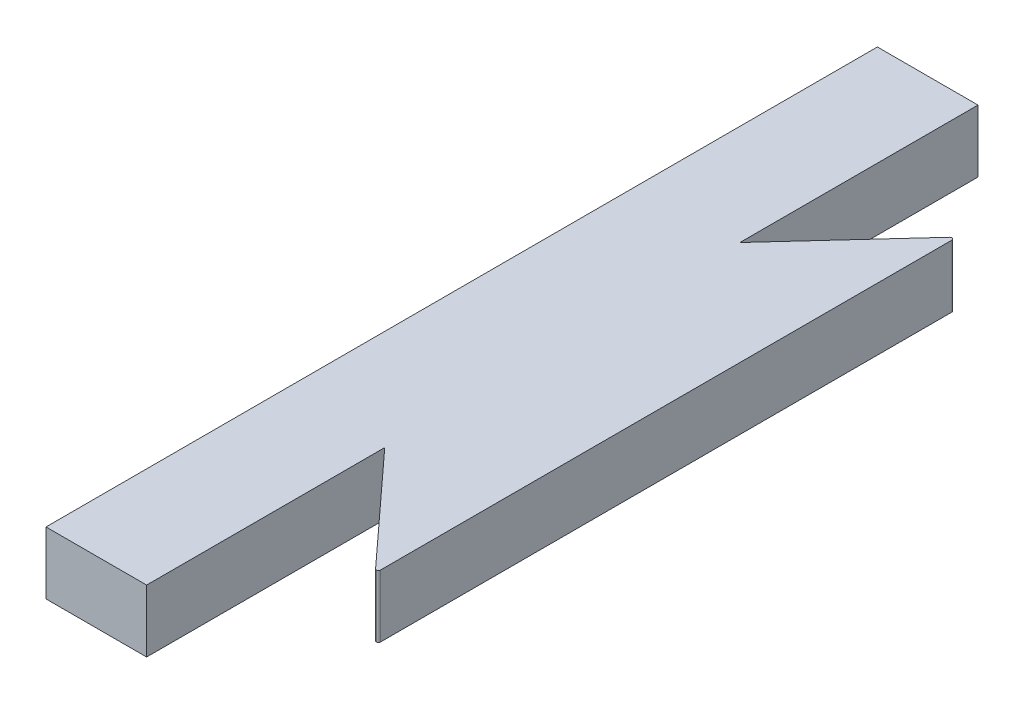
from build123d import *

# Parameters (mm, degrees)
CROQUIS1_R                 = 11
CROQUIS1_R_2               = 2
CROQUIS1_W                 = 30
CROQUIS1_H                 = 3
SALIENTE_EXTRUIR1_DEPTH    = 3
CROQUIS2_R                 = 13
CROQUIS2_R_2               = 11
SALIENTE_EXTRUIR2_DEPTH    = 4
CROQUIS3_R                 = 13
CROQUIS3_R_2               = 9
SALIENTE_EXTRUIR3_DEPTH    = 2
CHAFL_N1_SIZE              = 2
CHAFL_N2_SIZE              = 10
CORTAR_EXTRUIR1_DEPTH      = 10
CORTAR_EXTRUIR1_DEPTH_BACK = 10
CROQUIS4_W                 = 128.833311542
CROQUIS4_H                 = 58.233807115
REDONDEO1_R                = 0.1


with BuildPart() as part:
    # Croquis1 → Saliente-Extruir1 (new body)
    with BuildSketch(Plane(origin=(0, 0, 0), x_dir=(1, 0, 0), z_dir=(0, 1, 0))):
        Polygon((65, 8.543457495), (70, 14), (70, -14), (65, -8.543457495), (65, -20), (-65, -20), (-65, 20), (65, 20), align=None)
        with Locations((-50.129942902, 0)):
            Circle(CROQUIS1_R, mode=Mode.SUBTRACT)
        with Locations((-28.595127909, 0)):
            Circle(CROQUIS1_R_2, mode=Mode.SUBTRACT)
        with Locations((-13.595127909, 0)):
            Circle(CROQUIS1_R_2, mode=Mode.SUBTRACT)
        with Locations((50, 0)):
            Circle(CROQUIS1_R_2, mode=Mode.SUBTRACT)
        with Locations((25, 11)):
            Rectangle(CROQUIS1_W, CROQUIS1_H, mode=Mode.SUBTRACT)
        with Locations((25, -11)):
            Rectangle(CROQUIS1_W, CROQUIS1_H, mode=Mode.SUBTRACT)
    extrude(amount=SALIENTE_EXTRUIR1_DEPTH)

    # Croquis2 → Saliente-Extruir2 (add)
    with BuildSketch(Plane(origin=(0, 3, 0), x_dir=(1, 0, 0), z_dir=(0, 1, 0))):
        with Locations((-50.129942902, 0)):
            Circle(CROQUIS2_R)
        with Locations((-50.129942902, 0)):
            Circle(CROQUIS2_R_2, mode=Mode.SUBTRACT)
    extrude(amount=SALIENTE_EXTRUIR2_DEPTH)

    # Croquis3 → Saliente-Extruir3 (add)
    with BuildSketch(Plane(origin=(0, 7, 0), x_dir=(1, 0, 0), z_dir=(0, 1, 0))):
        with Locations((-50.129942902, 0)):
            Circle(CROQUIS3_R)
        with Locations((-50.129942902, 0)):
            Circle(CROQUIS3_R_2, mode=Mode.SUBTRACT)
    extrude(amount=SALIENTE_EXTRUIR3_DEPTH)

    # Chaflán1
    chafl_n1_edges = [part.edges().sort_by_distance(p)[0] for p in [
        (-63.129942902, 9, 0),
    ]]
    chamfer(chafl_n1_edges, length=CHAFL_N1_SIZE)

    # Chaflán2
    chafl_n2_edges = [part.edges().sort_by_distance(p)[0] for p in [
        (-65, 1.5, 20),
        (-65, 1.5, -20),
    ]]
    chamfer(chafl_n2_edges, length=CHAFL_N2_SIZE)

    # Croquis4 → Cortar-Extruir1 (cut, two sides: drawn at the far end of the back side and taken through both)
    with BuildSketch(Plane(origin=(0, 3, 0), x_dir=(1, 0, 0), z_dir=(0, 1, 0)).offset(-CORTAR_EXTRUIR1_DEPTH_BACK)):
        with Locations((-4.257997369, -0.71893589)):
            Rectangle(CROQUIS4_W, CROQUIS4_H)
    extrude(amount=CORTAR_EXTRUIR1_DEPTH + CORTAR_EXTRUIR1_DEPTH_BACK, mode=Mode.SUBTRACT)

    # Redondeo1
    redondeo1_edges = [part.edges().sort_by_distance(p)[0] for p in [
        (70, 1.5, -14),
        (70, 1.5, 14),
    ]]
    fillet(redondeo1_edges, radius=REDONDEO1_R)


solid = part.part
